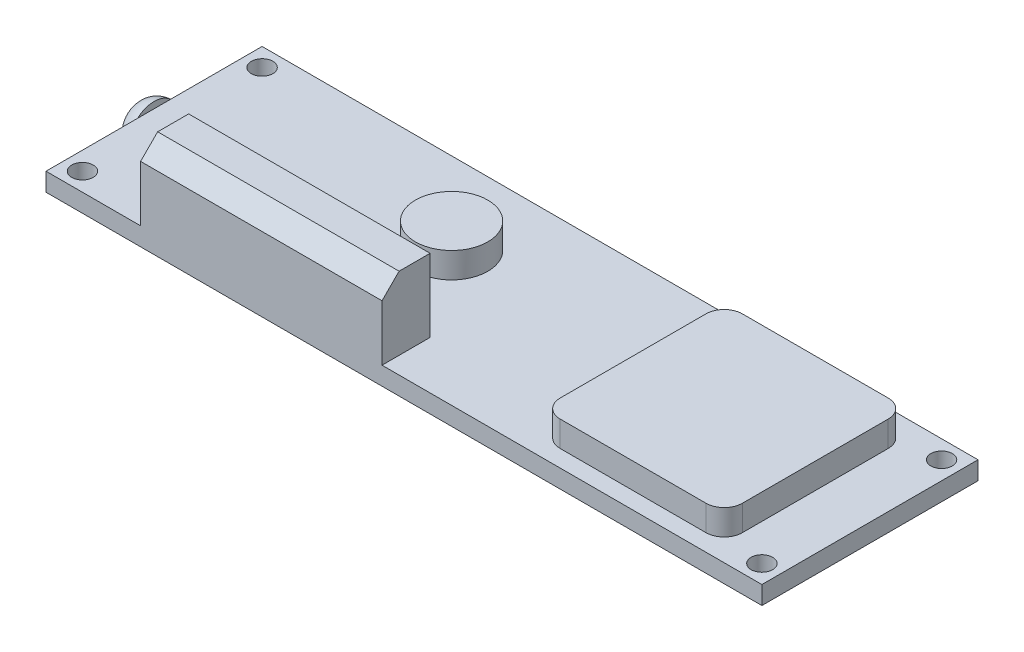
from build123d import *

# Parameters (mm, degrees)
SKETCH1_W           = 99.7966
SKETCH1_H           = 30.1244
BOSS_EXTRUDE1_DEPTH = 2.54
SKETCH2_W           = 33.65475448
SKETCH2_H           = 6.70026545
BOSS_EXTRUDE2_DEPTH = 10.16
SKETCH3_R           = 5.045566178
SKETCH3_W           = 25.4
SKETCH3_H           = 25.4
BOSS_EXTRUDE3_DEPTH = 3.556
FILLET1_R           = 2.54
SKETCH4_R           = 3.429
BOSS_EXTRUDE4_DEPTH = 2.54
FILLET2_R           = 2.54
CHAMFER1_SIZE       = 2.38
SKETCH5_W           = 0.314102564
SKETCH5_H           = 3.5
CUT_EXTRUDE1_DEPTH  = 0.762


with BuildPart() as part:
    # Sketch1 → Boss-Extrude1 (new body)
    with BuildSketch(Plane(origin=(0, 0, 0), x_dir=(1, 0, 0), z_dir=(0, 1, 0))):
        with Locations((49.8983, 15.0622)):
            Rectangle(SKETCH1_W, SKETCH1_H)
    extrude(amount=BOSS_EXTRUDE1_DEPTH)

    # Sketch2 → Boss-Extrude2 (add)
    with BuildSketch(Plane(origin=(0, 2.54, 0), x_dir=(1, 0, 0), z_dir=(0, 1, 0))):
        with Locations((30.013421746, 3.350132725)):
            Rectangle(SKETCH2_W, SKETCH2_H)
    extrude(amount=BOSS_EXTRUDE2_DEPTH)

    # Sketch3 → Boss-Extrude3 (add)
    with BuildSketch(Plane(origin=(0, 2.54, 0), x_dir=(1, 0, 0), z_dir=(0, 1, 0))):
        with Locations(Location((37.834363192, 18.707427202, 0), (0, 0, 90))):
            Circle(SKETCH3_R)
        with Locations((79.4766, 15.0622)):
            Rectangle(SKETCH3_W, SKETCH3_H)
    extrude(amount=BOSS_EXTRUDE3_DEPTH)

    # Fillet1
    fillet1_edges = [part.edges().sort_by_distance(p)[0] for p in [
        (92.1766, 4.318, -27.7622),
        (66.7766, 4.318, -27.7622),
        (66.7766, 4.318, -2.3622),
        (92.1766, 4.318, -2.3622),
    ]]
    fillet(fillet1_edges, radius=FILLET1_R)

    # Sketch4 → Boss-Extrude4 (add)
    with BuildSketch(Plane.ZY):
        with Locations((-15.0622, 0)):
            Circle(SKETCH4_R)
    extrude(amount=BOSS_EXTRUDE4_DEPTH)

    # Fillet2
    fillet2_edges = [part.edges().sort_by_distance(p)[0] for p in [
        (-2.54, 0, -18.4912),
    ]]
    fillet(fillet2_edges, radius=FILLET2_R - 0.0001)  # a hair under: the kernel refuses the full size

    # Chamfer1
    chamfer1_edges = [part.edges().sort_by_distance(p)[0] for p in [
        (30.013421746, 12.7, 0),
    ]]
    chamfer(chamfer1_edges, length=CHAMFER1_SIZE)

    # Sketch5 → Cut-Extrude1 (cut)
    # profile 1 of 7: a face of its own
    with BuildSketch(Plane(origin=(0, 2.54, 0), x_dir=(1, 0, 0), z_dir=(0, 1, 0))):
        Polygon((5.86903585, 16.453640261), (7.484420465, 12.953640261), (7.142974151, 12.953640261), (6.625546267, 14.075435133), (5.038907645, 14.075435133), (4.506756203, 12.953640261), (4.163907645, 12.953640261), (5.824164055, 16.453640261), align=None)
        Polygon((5.843094344, 15.771448755), (5.209280241, 14.434409492), (6.460081523, 14.434409492), align=None, mode=Mode.SUBTRACT)
    # profile 2 of 7: a face of its own
    with BuildSketch(Plane(origin=(0, 2.54, 0), x_dir=(1, 0, 0), z_dir=(0, 1, 0))):
        with Locations((8.269676876, 14.703640261)):
            Rectangle(SKETCH5_W, SKETCH5_H)
    # profile 3 of 7: a face of its own
    with BuildSketch(Plane(origin=(0, 2.54, 0), x_dir=(1, 0, 0), z_dir=(0, 1, 0))):
        Polygon((9.144676876, 12.953640261), (9.606716138, 16.453640261), (9.651587933, 16.453640261), (11.096599953, 13.581845389), (12.538106363, 16.453640261), (12.58367928, 16.453640261), (13.04852303, 12.953640261), (12.733018222, 12.953640261), (12.397882004, 15.472069748), (11.13446053, 12.953640261), (11.063647228, 12.953640261), (9.795317901, 15.477678723), (9.460882805, 12.953640261), align=None)
    # profile 4 of 7: a face of its own
    with BuildSketch(Plane(origin=(0, 2.54, 0), x_dir=(1, 0, 0), z_dir=(0, 1, 0))):
        Polygon((14.865830722, 16.453640261), (15.22831069, 16.453640261), (16.144676876, 15.021949556), (17.061043062, 16.453640261), (17.42352303, 16.453640261), (16.326267421, 14.738696351), (17.468394824, 12.953640261), (17.105914856, 12.953640261), (16.144676876, 14.455443146), (15.183438895, 12.953640261), (14.820958927, 12.953640261), (15.963787453, 14.738696351), align=None)
    # profile 5 of 7: a face of its own
    with BuildSketch(Plane(origin=(0, 2.54, 0), x_dir=(1, 0, 0), z_dir=(0, 1, 0))):
        Polygon((17.670317901, 16.094665902), (17.670317901, 16.453640261), (19.510061491, 16.453640261), (19.510061491, 16.094665902), (18.747240978, 16.094665902), (18.747240978, 12.953640261), (18.433138414, 12.953640261), (18.433138414, 16.094665902), align=None)
    # profile 6 of 7: a face of its own
    with BuildSketch(Plane(origin=(0, 2.54, 0), x_dir=(1, 0, 0), z_dir=(0, 1, 0))):
        with BuildLine():
            Line((20.04852303, 16.453640261), (20.748943703, 16.453640261))
            add(Edge.make_bspline(
                [(20.748943703, 16.453640261), (20.795684831, 16.453484675), (20.885432976, 16.453185933), (21.014006246, 16.45152017), (21.130833343, 16.446745814), (21.235853182, 16.442637231), (21.329063837, 16.435145289), (21.410751128, 16.427984642), (21.480538825, 16.418610981), (21.522784677, 16.409905558), (21.541912453, 16.405963979)],
                knots=[0, 0, 0, 0, 1.410062039, 2.707475311, 3.878576406, 4.937260626, 5.877586885, 6.699081471, 7.410979367, 8, 8, 8, 8], degree=3))
            add(Edge.make_bspline(
                [(21.541912453, 16.405963979), (21.567519077, 16.399637214), (21.618186066, 16.38711865), (21.691136132, 16.360659049), (21.760650456, 16.330039425), (21.826440281, 16.294075704), (21.888176072, 16.252500925), (21.946494383, 16.206032802), (22.001659846, 16.154925596), (22.051441476, 16.097890755), (22.098380528, 16.038054245), (22.137969154, 15.973350488), (22.172095634, 15.905688961), (22.199266151, 15.834381543), (22.221144124, 15.760119771), (22.236570364, 15.682230974), (22.245821551, 15.601069999), (22.246763407, 15.545712091), (22.247240978, 15.517642665)],
                knots=[0, 0, 0, 0, 1.027469482, 2.033020251, 3.019912614, 3.986113645, 4.951240523, 5.91722682, 6.890402269, 7.87763091, 8.8651537, 9.85103654, 10.82876324, 11.815024772, 12.821070561, 13.842952187, 14.906261191, 16, 16, 16, 16], degree=3))
            add(Edge.make_bspline(
                [(22.247240978, 15.517642665), (22.24577198, 15.47100756), (22.242905584, 15.380010392), (22.216180481, 15.247949511), (22.172403961, 15.124760196), (22.112080672, 15.010597558), (22.035261196, 14.907686913), (21.942936405, 14.817296458), (21.835054794, 14.741656545), (21.734625478, 14.68920374), (21.645911278, 14.655610832), (21.572877965, 14.631974473), (21.493210988, 14.613712508), (21.407673653, 14.597352376), (21.315909998, 14.585000682), (21.218139958, 14.575954087), (21.114293807, 14.570300038), (21.042954737, 14.569458033), (21.006255401, 14.569024876)],
                knots=[0, 0, 0, 0, 1.260483769, 2.459530307, 3.627416485, 4.787058657, 5.939039949, 7.08810263, 8.267026773, 9.491475466, 10.141966685, 10.831826277, 11.566392101, 12.351337768, 13.187381173, 14.07005841, 15.007169909, 16, 16, 16, 16], degree=3))
            Line((21.006255401, 14.569024876), (22.292112773, 12.953640261))
            Line((22.292112773, 12.953640261), (21.903691299, 12.953640261))
            Line((21.903691299, 12.953640261), (20.617833927, 14.569024876))
            Line((20.617833927, 14.569024876), (20.362625594, 14.569024876))
            Line((20.362625594, 14.569024876), (20.362625594, 12.953640261))
            Line((20.362625594, 12.953640261), (20.04852303, 12.953640261))
            Line((20.04852303, 12.953640261), (20.04852303, 16.453640261))
        make_face()
        with BuildLine():
            Line((20.362625594, 16.094665902), (20.362625594, 14.927999235))
            Line((20.362625594, 14.927999235), (21.003450914, 14.923091383))
            add(Edge.make_bspline(
                [(21.003450914, 14.923091383), (21.033370953, 14.923078146), (21.09136451, 14.92305249), (21.175265175, 14.927046266), (21.253385287, 14.931589584), (21.325426039, 14.93853893), (21.391419614, 14.947495002), (21.451333027, 14.958697986), (21.505264079, 14.971750048), (21.568162618, 14.991951674), (21.638399149, 15.023957692), (21.714730609, 15.070523191), (21.779732947, 15.12909231), (21.834650809, 15.196065766), (21.87878024, 15.269702015), (21.909892295, 15.349118384), (21.929634737, 15.432309982), (21.931963283, 15.48948809), (21.933138414, 15.518343787)],
                knots=[0, 0, 0, 0, 1.146690395, 2.22261258, 3.21895312, 4.145990853, 4.996080663, 5.770904154, 6.481378293, 7.121626537, 8.300444488, 9.431385265, 10.535395872, 11.636531494, 12.74115979, 13.810798291, 14.895190096, 16, 16, 16, 16], degree=3))
            add(Edge.make_bspline(
                [(21.933138414, 15.518343787), (21.931936293, 15.54649036), (21.929554128, 15.602266599), (21.910105359, 15.683922509), (21.877215978, 15.76098946), (21.83289374, 15.833153945), (21.778894585, 15.89865968), (21.715576772, 15.954706833), (21.644671577, 16.000956298), (21.578400379, 16.030510679), (21.519166166, 16.048630532), (21.467736506, 16.061381696), (21.409625028, 16.071626165), (21.34454957, 16.079834225), (21.272787939, 16.08688917), (21.193977288, 16.091640948), (21.108640508, 16.094454812), (21.049493577, 16.094593901), (21.018875594, 16.094665902)],
                knots=[0, 0, 0, 0, 1.101028733, 2.181837193, 3.264309656, 4.369019818, 5.486613113, 6.575447106, 7.666700264, 8.788928104, 9.402425223, 10.0903467, 10.862060571, 11.710948788, 12.657782767, 13.684531032, 14.801375019, 16, 16, 16, 16], degree=3))
            Line((21.018875594, 16.094665902), (20.362625594, 16.094665902))
        make_face(mode=Mode.SUBTRACT)
    # profile 7 of 7: a face of its own
    with BuildSketch(Plane(origin=(0, 2.54, 0), x_dir=(1, 0, 0), z_dir=(0, 1, 0))):
        Polygon((24.445958927, 16.453640261), (26.061343542, 12.953640261), (25.719897228, 12.953640261), (25.202469344, 14.075435133), (23.615830722, 14.075435133), (23.08367928, 12.953640261), (22.740830722, 12.953640261), (24.401087132, 16.453640261), align=None)
        Polygon((24.420017421, 15.771448755), (23.786203318, 14.434409492), (25.0370046, 14.434409492), align=None, mode=Mode.SUBTRACT)
    extrude(amount=-CUT_EXTRUDE1_DEPTH, mode=Mode.SUBTRACT)

    # Sketch9 → Ø1.5mm Dowel Hole1 (revolve, cut)
    with BuildSketch(Plane(origin=(97.2566, 2.54, -2.54), x_dir=(0, 0, 1), z_dir=(1, 0, 0))):
        Polygon((0, 0), (0, 3.441290929), (1.5, 2.54), (1.5, 0), align=None)
    f_1_5mm_dowel_hole1 = revolve(axis=Axis((97.2566, 8.89, -2.54), (0, -1, 0)), mode=Mode.SUBTRACT)

    # Mirror1: Ø1.5mm Dowel Hole1 across plane
    add(f_1_5mm_dowel_hole1.mirror(Plane.XY.offset(-15.0622)), mode=Mode.SUBTRACT)

    # Mirror2: Ø1.5mm Dowel Hole1 across plane
    add(f_1_5mm_dowel_hole1.mirror(Plane.ZY.offset(-49.8983)), mode=Mode.SUBTRACT)

    # Mirror2 copy 1 sketch → Mirror2 copy 1 (revolve, cut)
    with BuildSketch(Plane(origin=(2.54, 2.54, -27.5844), x_dir=(0, 0, -1), z_dir=(-1, 0, 0))):
        Polygon((0, 0), (0, 3.441290929), (1.5, 2.54), (1.5, 0), align=None)
    revolve(axis=Axis((2.54, 8.89, -27.5844), (0, -1, 0)), mode=Mode.SUBTRACT)


solid = part.part
